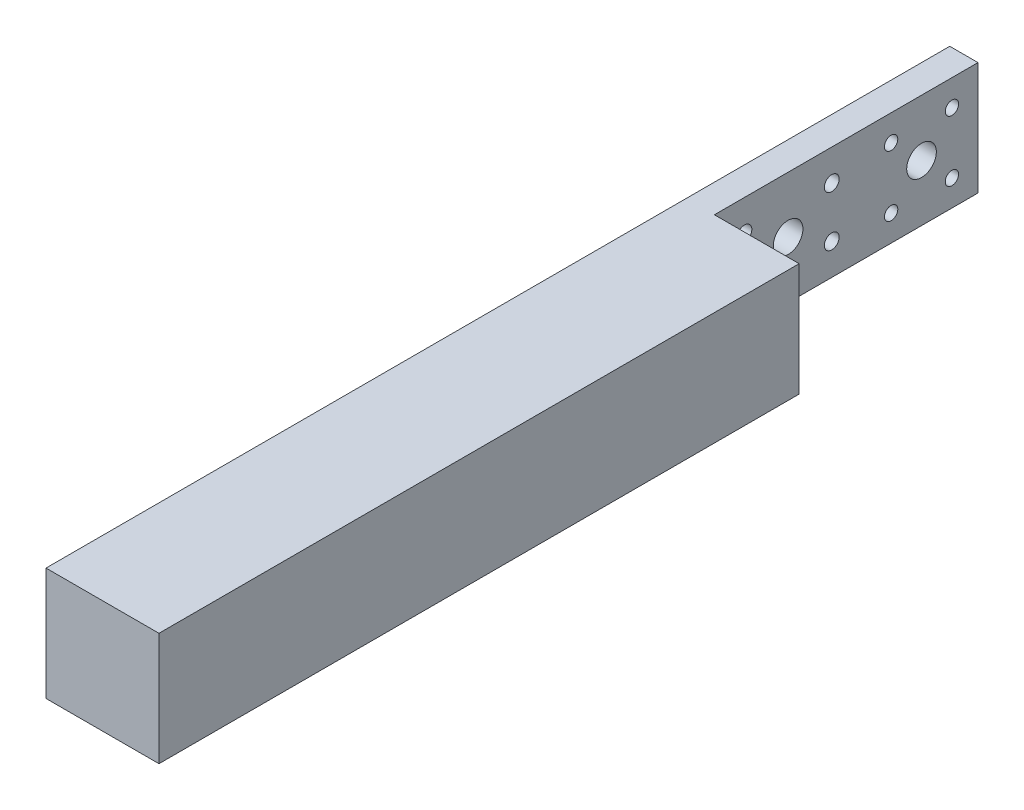
from build123d import *

# Parameters (mm, degrees)
SKETCH1_W           = 38.1
SKETCH1_H           = 38.1
BOSS_EXTRUDE1_DEPTH = 304.8
SKETCH2_R           = 5
CUT_EXTRUDE1_DEPTH  = 308.762168728
SKETCH4_R           = 2.5
CUT_EXTRUDE3_DEPTH  = 308.762168728
CIRPATTERN2_COUNT   = 6
SKETCH5_R           = 2.25
CUT_EXTRUDE4_DEPTH  = 308.762168728
CIRPATTERN3_COUNT   = 4
SKETCH6_W           = 88.9
SKETCH6_H           = 38.1
CUT_EXTRUDE5_DEPTH  = 28.575


with BuildPart() as part:
    # Sketch1 → Boss-Extrude1 (new body)
    with BuildSketch(Plane.XY):
        Rectangle(SKETCH1_W, SKETCH1_H)
    extrude(amount=BOSS_EXTRUDE1_DEPTH)

    # Sketch2 → Cut-Extrude1 (cut, through all)
    with BuildSketch(Plane(origin=(19.05, 0, 0), x_dir=(0, 0, -1), z_dir=(1, 0, 0))):
        with Locations((-19.05, 0)):
            Circle(SKETCH2_R)
        with Locations((-64.05, 0)):
            Circle(SKETCH2_R)
    extrude(amount=-CUT_EXTRUDE1_DEPTH, mode=Mode.SUBTRACT)

    # Sketch4 → Cut-Extrude3 (cut, through all)
    with BuildSketch(Plane(origin=(19.05, 0, 0), x_dir=(0, 0, -1), z_dir=(1, 0, 0))):
        with Locations((-78.772431864, 8.5)):
            Circle(SKETCH4_R)
    cut_extrude3 = extrude(amount=-CUT_EXTRUDE3_DEPTH, mode=Mode.SUBTRACT)

    # CirPattern2: Cut-Extrude3 ×6 about axis, 2 skipped
    cirpattern2_axis = Axis((-19.05, 0, 64.05), (1, 0, 0))
    add([cut_extrude3.rotate(cirpattern2_axis, i * 360 / CIRPATTERN2_COUNT) for i in range(1, CIRPATTERN2_COUNT) if i not in (2, 5)], mode=Mode.SUBTRACT)

    # Sketch5 → Cut-Extrude4 (cut, through all)
    with BuildSketch(Plane(origin=(19.05, 0, 0), x_dir=(0, 0, -1), z_dir=(1, 0, 0))):
        with Locations((-29.303048327, 10.253048327)):
            Circle(SKETCH5_R)
    cut_extrude4 = extrude(amount=-CUT_EXTRUDE4_DEPTH, mode=Mode.SUBTRACT)

    # CirPattern3: Cut-Extrude4 ×4 about axis
    cirpattern3_axis = Axis((-19.05, 0, 19.05), (1, 0, 0))
    for i in range(1, CIRPATTERN3_COUNT):
        add(cut_extrude4.rotate(cirpattern3_axis, i * 360 / CIRPATTERN3_COUNT), mode=Mode.SUBTRACT)

    # Sketch6 → Cut-Extrude5 (cut)
    with BuildSketch(Plane(origin=(19.05, 0, 0), x_dir=(0, 0, -1), z_dir=(1, 0, 0))):
        with Locations((-44.45, 0)):
            Rectangle(SKETCH6_W, SKETCH6_H)
    extrude(amount=-CUT_EXTRUDE5_DEPTH, mode=Mode.SUBTRACT)


solid = part.part
